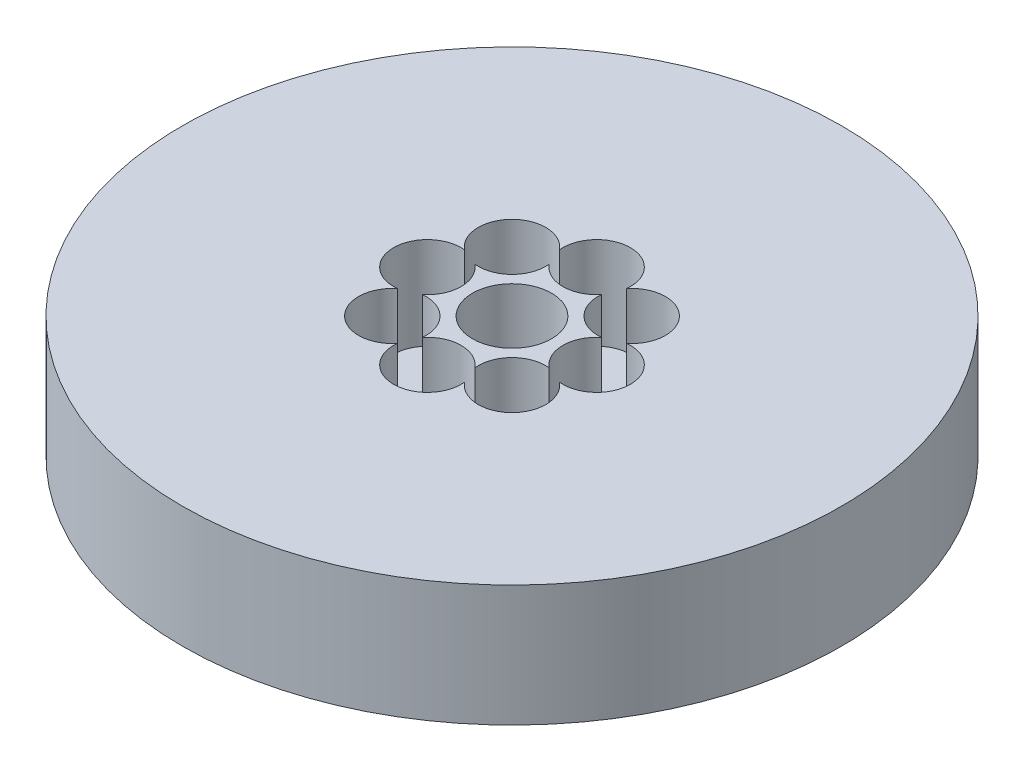
from build123d import *

# Parameters (mm, degrees)
SKETCH1_R           = 62.5
BOSS_EXTRUDE1_DEPTH = 23
SKETCH2_R           = 7.5
CUT_EXTRUDE1_DEPTH  = 92.331812639
SKETCH3_R           = 6.402299088
CUT_EXTRUDE2_DEPTH  = 17.518809877
CIRPATTERN1_COUNT   = 8


with BuildPart() as part:
    # Sketch1 → Boss-Extrude1 (new body)
    with BuildSketch(Plane(origin=(0, 0, 0), x_dir=(1, 0, 0), z_dir=(0, 1, 0))):
        Circle(SKETCH1_R)
    extrude(amount=BOSS_EXTRUDE1_DEPTH)

    # Sketch2 → Cut-Extrude1 (cut, through all)
    with BuildSketch(Plane(origin=(0, 0, 0), x_dir=(1, 0, 0), z_dir=(0, 1, 0))):
        Circle(SKETCH2_R)
    extrude(amount=CUT_EXTRUDE1_DEPTH, mode=Mode.SUBTRACT)

    # Sketch3 → Cut-Extrude2 (cut)
    with BuildSketch(Plane(origin=(0, 23, 0), x_dir=(1, 0, 0), z_dir=(0, 1, 0))):
        with Locations((-16.05131074, 0)):
            Circle(SKETCH3_R)
    cut_extrude2 = extrude(amount=-CUT_EXTRUDE2_DEPTH, mode=Mode.SUBTRACT)

    # CirPattern1: Cut-Extrude2 ×8 about axis
    cirpattern1_axis = Axis((0, 0, 0), (0, 1, 0))
    for i in range(1, CIRPATTERN1_COUNT):
        add(cut_extrude2.rotate(cirpattern1_axis, i * 360 / CIRPATTERN1_COUNT), mode=Mode.SUBTRACT)


solid = part.part
